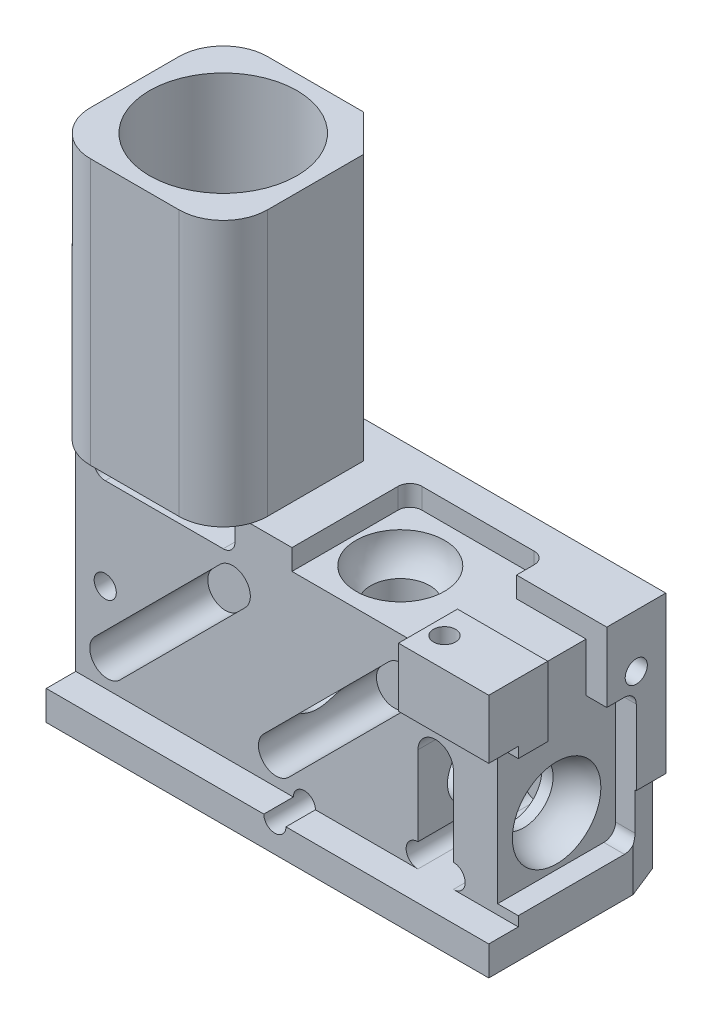
from build123d import *

# Parameters (mm, degrees)
SKETCH1_W                        = 15
SKETCH1_H                        = 6
MAIN_BODY_EXT_DEPTH              = 8.3
EMISSION_PATH_EXT_DEPTH          = 9
SKETCH3_R                        = 1.25
EMISSION_AND_GRIN_CUT_DEPTH      = 20.092931
SKETCH4_R                        = 1
DRUM_LENS_CUT_DEPTH              = 13
SKETCH41_R                       = 1
ADDTL_LIGHT_SOURCE_DEPTH         = 5
SKETCH5_W                        = 15
SKETCH5_H                        = 7.3
FILTERCOVER_CUT1_DEPTH           = 1
TOP_LED_SCREW_W                  = 3.06
TOP_LED_SCREW_H                  = 2
BOSS_EXTRUDE1_DEPTH              = 1
FILTERSET_CUT2_DEPTH             = 4
SKETCH10_R                       = 2.5
EMISSION_LENS_CUT_DEPTH          = 8.5
SKETCH15_R                       = 0.795
MAGNETS_CUT_DEPTH                = 0.9
SCREW_HOLES_CUT_DEPTH            = 20.507434
SCREW_HOLES_CUT_DEPTH_BACK       = 2.5
SKETCH18_R                       = 0.375
EXTERNAL_FILLET_1_R              = 1.5
VERTICAL_PATH_CUT_DEPTH          = 14.011149
VERTICAL_PATH_CUT_DEPTH_BACK     = 4
SKETCH28_R                       = 1.5
SET_SCREW_NOTCH_DEPTH            = 3
CUT_EXTRUDE_ORIGINAL_LIGHT_DEPTH = 0.7
CUT_EXTRUDE_ADDTL_LIGHT_DEPTH    = 0.7
SKETCH29_R                       = 0.375
SIDE_LED_SCREW_DEPTH             = 2.5
SKETCH32_W                       = 2
SKETCH32_H                       = 2.36
SIDE_WIRE_SLOT_CUT_DEPTH         = 0.7
SKETCH45_W                       = 2.36
SKETCH45_H                       = 2
TOP_LED_SLOT_DEPTH               = 0.7
CUT_EXTRUDE16_DEPTH              = 9
CUT_EXTRUDE17_REACH              = 13.945
SKETCH37_R                       = 2
SKETCH48_R                       = 0.5
PEG_EXTRUDE_DEPTH                = 2
SKETCH51_R                       = 0.375
TOP_LE_SCREW_DEPTH               = 2.1


with BuildPart() as part:
    # Sketch1 → Main Body Ext (new body)
    with BuildSketch(Plane(origin=(0, 0, 0), x_dir=(1, 0, 0), z_dir=(0, 1, 0))):
        Rectangle(SKETCH1_W, SKETCH1_H)
    extrude(amount=MAIN_BODY_EXT_DEPTH)

    # Sketch8 → Emission Path Ext (add)
    with BuildSketch(Plane(origin=(0, 8.3, 0), x_dir=(1, 0, 0), z_dir=(0, 1, 0))):
        Polygon((-2.75, 3), (-1.5, 1.75), (-1.5, -3), (-7.5, -3), (-7.5, 3), align=None)
    extrude(amount=EMISSION_PATH_EXT_DEPTH)

    # Sketch3 → Emission and Grin Cut (cut, through all)
    with BuildSketch(Plane.XZ):
        with Locations(Location((-4.5, 0, 0), (0, 0, 270))):
            Circle(SKETCH3_R)
    extrude(amount=-EMISSION_AND_GRIN_CUT_DEPTH, mode=Mode.SUBTRACT)

    # Sketch4 → Drum Lens Cut (cut)
    with BuildSketch(Plane(origin=(7.5, 0, 0), x_dir=(0, 0, -1), z_dir=(1, 0, 0))):
        with Locations((0, 3)):
            Circle(SKETCH4_R)
    extrude(amount=-DRUM_LENS_CUT_DEPTH, mode=Mode.SUBTRACT)

    # Sketch41 → Addtl Light Source (cut)
    with BuildSketch(Plane(origin=(0, 8.3, 0), x_dir=(1, 0, 0), z_dir=(0, 1, 0))):
        with Locations(Location((1.5, 0, 0), (0, 0, 270))):
            Circle(SKETCH41_R)
    extrude(amount=-ADDTL_LIGHT_SOURCE_DEPTH, mode=Mode.SUBTRACT)

    # Sketch5 → FilterCover Cut1 (cut)
    with BuildSketch(Plane.XY.offset(3)):
        with Locations((0, 4.65)):
            Rectangle(SKETCH5_W, SKETCH5_H)
    extrude(amount=-FILTERCOVER_CUT1_DEPTH, mode=Mode.SUBTRACT)

    # Top-LED-Screw → Boss-Extrude1 (add)
    with BuildSketch(Plane.XY.offset(2)):
        with Locations((5.97, 7.3)):
            Rectangle(TOP_LED_SCREW_W, TOP_LED_SCREW_H)
    extrude(amount=BOSS_EXTRUDE1_DEPTH)

    # Sketch6 → FilterSet Cut2 (cut)
    with BuildSketch(Plane.XY.offset(2)):
        with BuildLine():
            Line((5.3, 4.5), (5.3, 1.8))
            ThreePointArc((5.3, 1.8), (5.7, 1.4), (5.3, 1))
            Line((5.3, 1), (4.1, 1))
            ThreePointArc((4.1, 1), (3.7, 1.4), (4.1, 1.8))
            Line((4.1, 1.8), (4.1, 4.5))
            ThreePointArc((4.1, 4.5), (4.7, 5.1), (5.3, 4.5))
        make_face()
        with BuildLine():
            Line((-6.9, 7.9), (-6.9, 7.5))
            ThreePointArc((-6.9, 7.5), (-6.782843, 7.217157), (-6.5, 7.1))
            Line((-6.5, 7.1), (-2.5, 7.1))
            ThreePointArc((-2.5, 7.1), (-2.217157, 7.217157), (-2.1, 7.5))
            Line((-2.1, 7.5), (-2.1, 7.9))
            ThreePointArc((-2.1, 7.9), (-2.217157, 8.182843), (-2.5, 8.3))
            Line((-2.5, 8.3), (-6.5, 8.3))
            ThreePointArc((-6.5, 8.3), (-6.782843, 8.182843), (-6.9, 7.9))
        make_face()
        with BuildLine():
            Line((-2.605887, 6.591169), (-6.848528, 2.348528))
            ThreePointArc((-6.848528, 2.348528), (-6.848528, 1.5), (-6, 1.5))
            Line((-6, 1.5), (-1.757359, 5.742641))
            ThreePointArc((-1.757359, 5.742641), (-1.757359, 6.591169), (-2.605887, 6.591169))
        make_face()
        with BuildLine():
            Line((3.112092, 6.591169), (-1.130548, 2.348528))
            ThreePointArc((-1.130548, 2.348528), (-1.130548, 1.5), (-0.28202, 1.5))
            Line((-0.28202, 1.5), (3.96062, 5.742641))
            ThreePointArc((3.96062, 5.742641), (3.96062, 6.591169), (3.112092, 6.591169))
        make_face()
    extrude(amount=-FILTERSET_CUT2_DEPTH, mode=Mode.SUBTRACT)

    # Sketch10 → Emission Lens Cut (cut)
    with BuildSketch(Plane(origin=(0, 17.3, 0), x_dir=(1, 0, 0), z_dir=(0, 1, 0))):
        with Locations(Location((-4.5, 0, 0), (0, 0, 270))):
            Circle(SKETCH10_R)
    extrude(amount=-EMISSION_LENS_CUT_DEPTH, mode=Mode.SUBTRACT)

    # Sketch15 → Magnets Cut (cut)
    with BuildSketch(Plane.XZ):
        with Locations(Location((-6.25, -1.875, 0), (0, 0, 270))):
            Circle(SKETCH15_R)
        with Locations(Location((-6.25, 1.875, 0), (0, 0, 270))):
            Circle(SKETCH15_R)
        with Locations(Location((-1.5, 0, 0), (0, 0, 270))):
            Circle(SKETCH15_R)
    extrude(amount=-MAGNETS_CUT_DEPTH, mode=Mode.SUBTRACT)

    # Sketch18 → Screw Holes Cut (cut, two sides: drawn at the far end of the back side and taken through both)
    with BuildSketch(Plane.XY.offset(2).offset(-SCREW_HOLES_CUT_DEPTH_BACK)):
        with Locations(Location((-6.5, 4, 0), (0, 0, 180))):
            Circle(SKETCH18_R)
        with Locations(Location((6, 5.8, 0), (0, 0, 180))):
            Circle(SKETCH18_R)
        with Locations((0.25, 1)):
            Circle(SKETCH18_R)
    extrude(amount=SCREW_HOLES_CUT_DEPTH + SCREW_HOLES_CUT_DEPTH_BACK, mode=Mode.SUBTRACT)

    # External Fillet 1
    # the kernel refuses this fillet: 1.5 mm, written as the material it takes off along each edge
    with BuildSketch(Plane(origin=(-7.5, -3.75, -3), x_dir=(1, 0, 0), z_dir=(0, 1, 0))) as external_fillet_1_piece_1:
        with BuildLine():
            CenterArc((EXTERNAL_FILLET_1_R, -EXTERNAL_FILLET_1_R), EXTERNAL_FILLET_1_R, 90, 90)
            Line((0, -EXTERNAL_FILLET_1_R), (0, 0))
            Line((0, 0), (EXTERNAL_FILLET_1_R, 0))
        make_face()
    extrude(amount=24.8, mode=Mode.SUBTRACT)
    with BuildSketch(Plane(origin=(-1.5, 8.3, 3), x_dir=(0, 0, -1), z_dir=(0, 1, 0))) as external_fillet_1_piece_2:
        with BuildLine():
            CenterArc((EXTERNAL_FILLET_1_R, EXTERNAL_FILLET_1_R), EXTERNAL_FILLET_1_R, 180, 90)
            Line((0, EXTERNAL_FILLET_1_R), (0, 0))
            Line((0, 0), (EXTERNAL_FILLET_1_R, 0))
        make_face()
    extrude(amount=12.75, mode=Mode.SUBTRACT)

    # Sketch28 → Vertical-Path-Cut (cut, two sides: drawn at the far end of the back side and taken through both)
    with BuildSketch(Plane(origin=(0, 7.1, 0), x_dir=(1, 0, 0), z_dir=(0, 1, 0)).offset(-VERTICAL_PATH_CUT_DEPTH_BACK)):
        with Locations(Location((-4.5, 0, 0), (0, 0, 180))):
            Circle(SKETCH28_R)
    extrude(amount=VERTICAL_PATH_CUT_DEPTH + VERTICAL_PATH_CUT_DEPTH_BACK, mode=Mode.SUBTRACT)

    # Sketch14 → Set-Screw-Notch (cut)
    with BuildSketch(Plane.XZ):
        Polygon((7.5, -3), (7.5, -1.891585), (7.056634, -3), align=None)
    extrude(amount=-SET_SCREW_NOTCH_DEPTH, mode=Mode.SUBTRACT)

    # Sketch12 → Cut-Extrude Original Light (cut)
    with BuildSketch(Plane(origin=(7.5, 0, 0), x_dir=(0, 0, -1), z_dir=(1, 0, 0))):
        with BuildLine():
            Line((1.6, 5.94), (-1.6, 5.94))
            Line((-1.6, 5.94), (-2, 5.94))
            Line((-2, 5.94), (-2, 1.33))
            Line((-2, 1.33), (1.6, 1.33))
            ThreePointArc((1.6, 1.33), (1.882843, 1.447157), (2, 1.73))
            Line((2, 1.73), (2, 5.54))
            ThreePointArc((2, 5.54), (1.882843, 5.822843), (1.6, 5.94))
        make_face()
    extrude(amount=-CUT_EXTRUDE_ORIGINAL_LIGHT_DEPTH, mode=Mode.SUBTRACT)

    # Sketch44 → Cut-Extrude Addtl Light (cut)
    with BuildSketch(Plane(origin=(0, 8.3, 0), x_dir=(1, 0, 0), z_dir=(0, 1, 0))):
        with BuildLine():
            Line((-0.17, -2), (4.44, -2))
            Line((4.44, -2), (4.44, 1.6))
            ThreePointArc((4.44, 1.6), (4.322843, 1.882843), (4.04, 2))
            Line((4.04, 2), (0.23, 2))
            ThreePointArc((0.23, 2), (-0.052843, 1.882843), (-0.17, 1.6))
            Line((-0.17, 1.6), (-0.17, -2))
        make_face()
    extrude(amount=-CUT_EXTRUDE_ADDTL_LIGHT_DEPTH, mode=Mode.SUBTRACT)

    # Sketch29 → Side-LED-Screw (cut)
    with BuildSketch(Plane(origin=(7.5, 0, 0), x_dir=(0, 0, -1), z_dir=(1, 0, 0))):
        with Locations((2, 6.5)):
            Circle(SKETCH29_R)
    extrude(amount=-SIDE_LED_SCREW_DEPTH, mode=Mode.SUBTRACT)

    # Sketch32 → Side-Wire-Slot-Cut (cut)
    with BuildSketch(Plane(origin=(7.5, 0, 0), x_dir=(0, 0, -1), z_dir=(1, 0, 0))):
        with Locations((0, 7.12)):
            Rectangle(SKETCH32_W, SKETCH32_H)
    extrude(amount=-SIDE_WIRE_SLOT_CUT_DEPTH, mode=Mode.SUBTRACT)

    # Sketch45 → Top-LED-slot (cut)
    with BuildSketch(Plane(origin=(0, 8.3, 0), x_dir=(1, 0, 0), z_dir=(0, 1, 0))):
        with Locations((5.62, 0)):
            Rectangle(SKETCH45_W, SKETCH45_H)
    extrude(amount=-TOP_LED_SLOT_DEPTH, mode=Mode.SUBTRACT)

    # Sketch33 → Side-BallLens_Cut (revolve, cut)
    with BuildSketch(Plane.XY, mode=Mode.PRIVATE) as side_balllens_cut_sk:
        with BuildLine():
            Line((6.8, 3), (5.3, 3))
            ThreePointArc((5.3, 3), (5.73934, 4.06066), (6.8, 4.5))
            Line((6.8, 4.5), (6.8, 3))
        make_face()
    revolve(side_balllens_cut_sk.sketch.rotate(Axis((6.8, 3, 0), (-1, 0, 0)), 84.26086), axis=Axis((6.8, 3, 0), (-1, 0, 0)), mode=Mode.SUBTRACT)

    # Sketch47 → Top-BallLens_Cut (revolve, cut)
    with BuildSketch(Plane(origin=(1.5, 0, 0), x_dir=(0, 0, -1), z_dir=(1, 0, 0))):
        with BuildLine():
            Line((-1.5, 7.6), (0, 7.6))
            Line((0, 7.6), (0, 6.137287))
            ThreePointArc((0, 6.137287), (-1.04756, 6.563498), (-1.5, 7.6))
        make_face()
    revolve(axis=Axis((1.5, 7.6, 0), (0, -1, 0)), mode=Mode.SUBTRACT)

    # Sketch36 → Cut-Extrude16 (cut)
    with BuildSketch(Plane(origin=(0, 17.3, 0), x_dir=(1, 0, 0), z_dir=(0, 1, 0))):
        with BuildLine():
            Line((-7.5, -1.5), (-7.5, -3))
            Line((-7.5, -3), (-6, -3))
            ThreePointArc((-6, -3), (-7.06066, -2.56066), (-7.5, -1.5))
        make_face()
    extrude(amount=-CUT_EXTRUDE16_DEPTH, mode=Mode.SUBTRACT)

    # Sketch37 → Cut-Extrude17 (cut, up to next)
    with BuildSketch(Plane(origin=(0, 8.8, 0), x_dir=(1, 0, 0), z_dir=(0, 1, 0)), mode=Mode.PRIVATE) as cut_extrude17_sk1:
        with Locations(Location((-4.5, 0, 0), (0, 0, 180))):
            Circle(SKETCH37_R)
    cut_extrude17_tool1 = extrude(cut_extrude17_sk1.sketch, amount=-CUT_EXTRUDE17_REACH, mode=Mode.PRIVATE) & part.part
    add(cut_extrude17_tool1.solids().sort_by_distance((-4.5, 8.8, 0))[0], mode=Mode.SUBTRACT)

    # Sketch48 → Peg-extrude (cut)
    with BuildSketch(Plane.XZ):
        with Locations(Location((-2, -2, 0), (0, 0, 270))):
            Circle(SKETCH48_R)
    extrude(amount=-PEG_EXTRUDE_DEPTH, mode=Mode.SUBTRACT)

    # Sketch51 → Top-LE-Screw (cut)
    with BuildSketch(Plane(origin=(0, 8.3, 0), x_dir=(1, 0, 0), z_dir=(0, 1, 0))):
        with Locations(Location((5, -2, 0), (0, 0, 270))):
            Circle(SKETCH51_R)
    extrude(amount=-TOP_LE_SCREW_DEPTH, mode=Mode.SUBTRACT)


solid = part.part
